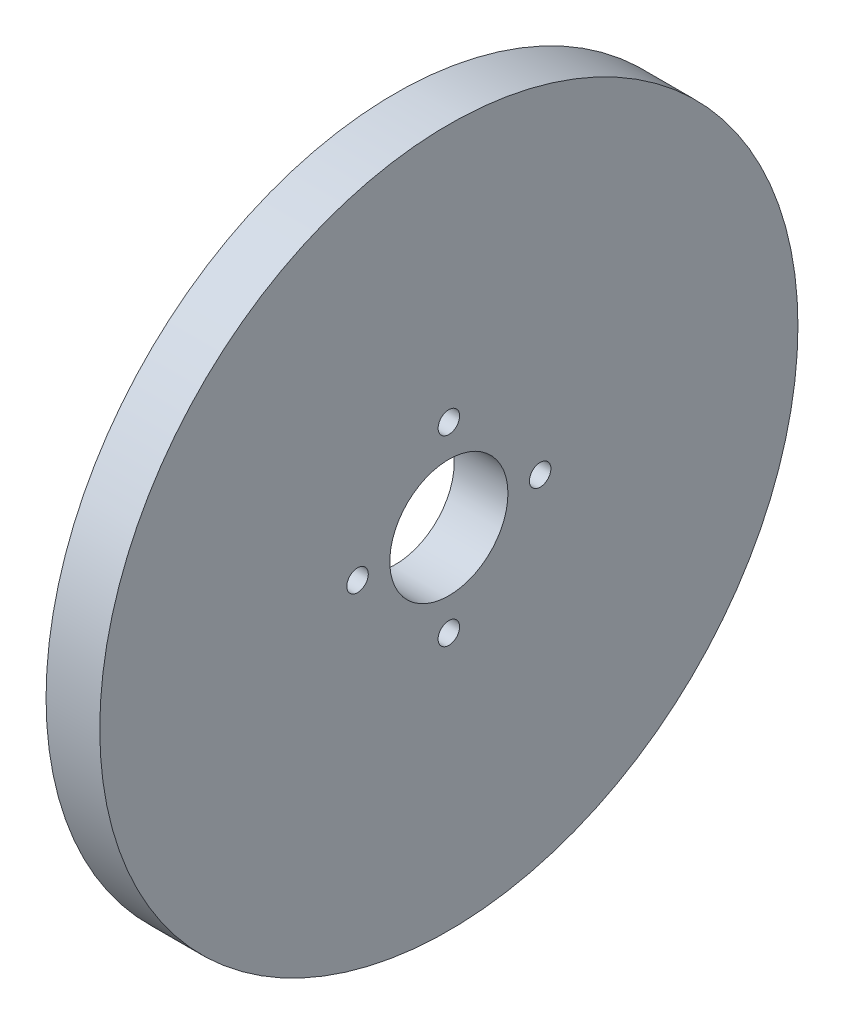
from build123d import *

# Parameters (mm, degrees)
SKETCH1_R           = 65
BOSS_EXTRUDE1_DEPTH = 5
SKETCH3_R           = 11
CUT_EXTRUDE2_DEPTH  = 93.466210045
SKETCH5_R           = 2
CUT_EXTRUDE5_DEPTH  = 93.466210045


with BuildPart() as part:
    # Sketch1 → Boss-Extrude1 (new, symmetric)
    with BuildSketch(Plane(origin=(0, 0, 0), x_dir=(0, 0, -1), z_dir=(1, 0, 0))):
        Circle(SKETCH1_R)
    extrude(amount=BOSS_EXTRUDE1_DEPTH, both=True)

    # Sketch3 → Cut-Extrude2 (cut, through all)
    with BuildSketch(Plane(origin=(5, 0, 0), x_dir=(0, 0, -1), z_dir=(1, 0, 0))):
        Circle(SKETCH3_R)
    extrude(amount=-CUT_EXTRUDE2_DEPTH, mode=Mode.SUBTRACT)

    # Sketch5 → Cut-Extrude5 (cut, through all)
    with BuildSketch(Plane(origin=(5, 0, 0), x_dir=(0, 0, -1), z_dir=(1, 0, 0))):
        with Locations((0, 17)):
            Circle(SKETCH5_R)
        with Locations((-17, 0)):
            Circle(SKETCH5_R)
        with Locations((0, -17)):
            Circle(SKETCH5_R)
        with Locations((17, 0)):
            Circle(SKETCH5_R)
    extrude(amount=-CUT_EXTRUDE5_DEPTH, mode=Mode.SUBTRACT)


solid = part.part
